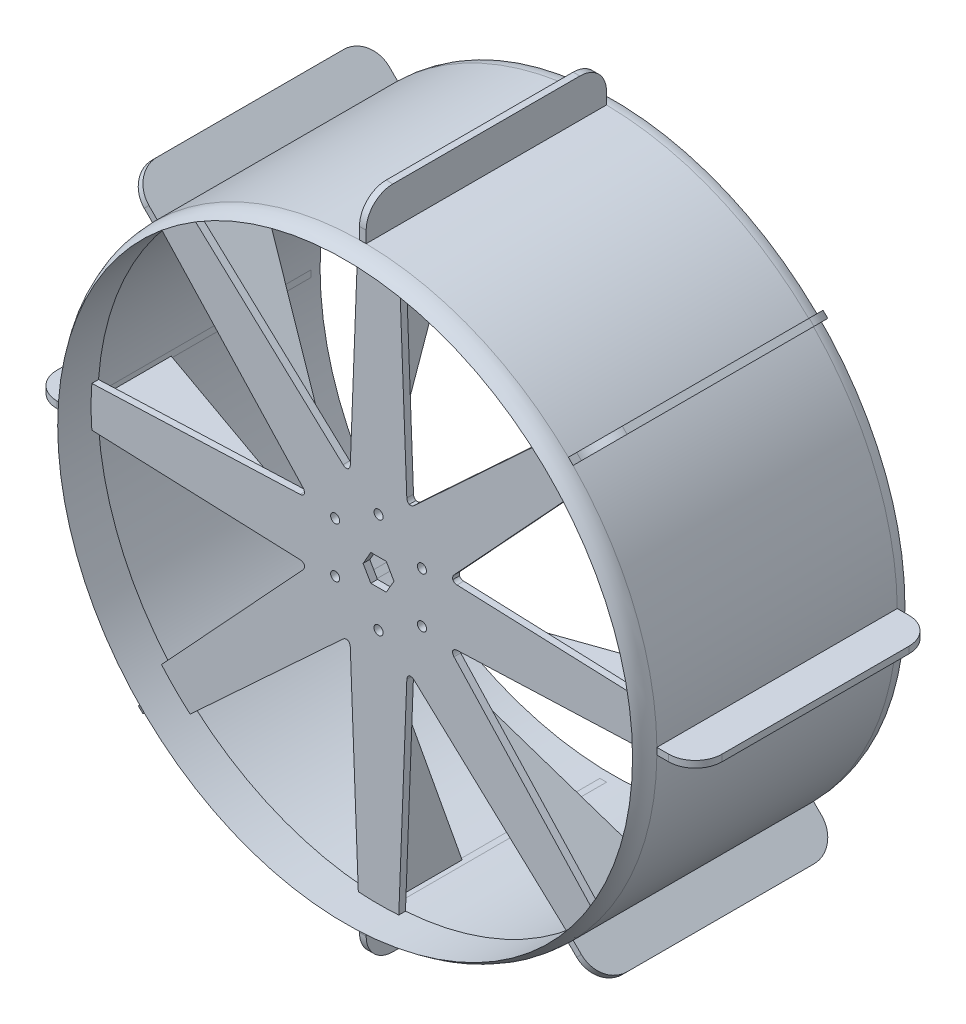
from build123d import *

# Parameters (mm, degrees)
SKETCH1_R                 = 139.7
BOSS_EXTRUDE1_DEPTH       = 127
SKETCH2_R                 = 138.90625
CUT_EXTRUDE1_DEPTH        = 107.95
SKETCH3_R                 = 136.525
CUT_EXTRUDE2_DEPTH        = 15.875
CUT_EXTRUDE3_REACH        = 228.674
SKETCH5_R                 = 2.15011
CUT_EXTRUDE4_DEPTH        = 227.673654457
CIRPATTERN2_COUNT         = 6
CUT_EXTRUDE5_REACH        = 228.674
SKETCH6_R                 = 136.525
SKETCH6_R_2               = 38.1
BOSS_EXTRUDE2_DEPTH       = 3.175
CIRPATTERN3_COUNT         = 8
FILLET2_R                 = 2.54
BOSS_EXTRUDE3_DEPTH       = 1.5875
CIRPATTERN4_COUNT         = 8
FILLET3_R                 = 12.7
SKETCH10_W                = 114.180326624
SKETCH10_H                = 19.05
BOSS_EXTRUDE5_DEPTH       = 1.5875
FILLET5_R                 = 12.7
CIRPATTERN14_COUNT        = 8
FILLET5_OF_CIRPATTERN14_R = 12.7


with BuildPart() as part:
    # Sketch1 → Boss-Extrude1 (new body)
    with BuildSketch(Plane.XY):
        Circle(SKETCH1_R)
    extrude(amount=BOSS_EXTRUDE1_DEPTH)

    # Sketch2 → Cut-Extrude1 (cut)
    with BuildSketch(Plane(origin=(0, 0, 0), x_dir=(-1, 0, 0), z_dir=(0, 0, -1))):
        Circle(SKETCH2_R)
    extrude(amount=-CUT_EXTRUDE1_DEPTH, mode=Mode.SUBTRACT)

    # Sketch3 → Cut-Extrude2 (cut)
    with BuildSketch(Plane.XY.offset(127)):
        Circle(SKETCH3_R)
    extrude(amount=-CUT_EXTRUDE2_DEPTH, mode=Mode.SUBTRACT)

    # Sketch4 → Cut-Extrude3 (cut, up to next)
    with BuildSketch(Plane.XY.offset(111.125), mode=Mode.PRIVATE) as cut_extrude3_sk1:
        Polygon((3.666174209, 6.35), (-3.666174209, 6.35), (-7.332348419, 0), (-3.666174209, -6.35), (3.666174209, -6.35), (7.332348419, 0), align=None)
    cut_extrude3_tool1 = extrude(cut_extrude3_sk1.sketch, amount=-CUT_EXTRUDE3_REACH, mode=Mode.PRIVATE) & part.part
    add(cut_extrude3_tool1.solids().sort_by_distance((0, 0, 111.125))[0], mode=Mode.SUBTRACT)

    # Sketch5 → Cut-Extrude4 (cut, through all)
    with BuildSketch(Plane.XY.offset(111.125)):
        with Locations((0, -23.8125)):
            Circle(SKETCH5_R)
    cut_extrude4 = extrude(amount=-CUT_EXTRUDE4_DEPTH, mode=Mode.SUBTRACT)

    # CirPattern2: Cut-Extrude4 ×6 about axis
    cirpattern2_axis = Axis((0, 0, 0), (0, 0, 1))
    for i in range(1, CIRPATTERN2_COUNT):
        add(cut_extrude4.rotate(cirpattern2_axis, i * 360 / CIRPATTERN2_COUNT), mode=Mode.SUBTRACT)

    # Sketch6 → Cut-Extrude5 (cut, up to next)
    with BuildSketch(Plane.XY.offset(111.125), mode=Mode.PRIVATE) as cut_extrude5_sk1:
        Circle(SKETCH6_R)
        Circle(SKETCH6_R_2, mode=Mode.SUBTRACT)
    cut_extrude5_tool1 = extrude(cut_extrude5_sk1.sketch, amount=-CUT_EXTRUDE5_REACH, mode=Mode.PRIVATE) & part.part
    add(cut_extrude5_tool1.solids().sort_by_distance((-132.66349, 0, 111.125))[0], mode=Mode.SUBTRACT)


with BuildPart() as cut_extrude5_piece_1:
    # of the separate pieces the step leaves, piece 1, a body of its own (cut_extrude5_pieces)
    add(part.part.solids().sort_by_distance((139.7, 0, 0))[0])



with BuildPart() as cut_extrude5_piece_2:
    # of the separate pieces the step leaves, piece 2, a body of its own (cut_extrude5_pieces)
    add(part.part.solids().sort_by_distance((38.1, 0, 111.125))[0])


with BuildPart() as cut_extrude5_piece_1_1:
    add(cut_extrude5_piece_1.part)

    add(cut_extrude5_piece_2.part)  # Boss-Extrude2 merges Cut-Extrude5 piece 2
    # Sketch7 → Boss-Extrude2 (add)
    with BuildSketch(Plane.XY.offset(111.125)):
        with BuildLine():
            Line((-9.525, 138.579293778), (-13.49375, 35.630446404))
            ThreePointArc((-13.49375, 35.630446404), (0, 38.1), (13.49375, 35.630446404))
            Line((13.49375, 35.630446404), (9.525, 138.579293778))
            ThreePointArc((9.525, 138.579293778), (0, 138.90625), (-9.525, 138.579293778))
        make_face()
    boss_extrude2 = extrude(amount=-BOSS_EXTRUDE2_DEPTH)

    # CirPattern3: Boss-Extrude2 ×8 about axis
    cirpattern3_axis = Axis((0, 0, 0), (0, 0, 1))
    for i in range(1, CIRPATTERN3_COUNT):
        add(boss_extrude2.rotate(cirpattern3_axis, i * 360 / CIRPATTERN3_COUNT))

    # Fillet2
    # the kernel refuses this fillet: 2.54 mm, written as the material it adds along each edge
    with BuildSketch(Plane(origin=(35.630446404, 13.49375, 111.125), x_dir=(-0.3736280373482853, 0.9275786164564535, 0), z_dir=(0, 0, -1)), Plane(origin=(34.736052398, -15.65300814, 111.125), x_dir=(0.3917022109295996, 0.9200920486303876, 0), z_dir=(0, 0, -1)), Plane(origin=(13.49375, -35.630446404, 111.125), x_dir=(0.9275786164564527, 0.37362803734828726, 0), z_dir=(0, 0, -1)), Plane(origin=(-15.65300814, -34.736052398, 111.125), x_dir=(0.9200920486303856, -0.39170221092960417, 0), z_dir=(0, 0, -1)), Plane(origin=(-35.630446404, -13.49375, 111.125), x_dir=(0.3736280373482815, -0.927578616456455, 0), z_dir=(0, 0, -1)), Plane(origin=(-34.736052398, 15.65300814, 111.125), x_dir=(-0.3917022109296025, -0.9200920486303863, 0), z_dir=(0, 0, -1)), Plane(origin=(-13.49375, 35.630446404, 111.125), x_dir=(-0.9275786164564532, -0.3736280373482857, 0), z_dir=(0, 0, -1)), Plane(origin=(15.65300814, 34.736052398, 111.125), x_dir=(-0.9200920486303862, 0.39170221092960295, 0), z_dir=(0, 0, -1))) as fillet2_piece_1:
        with BuildLine():
            CenterArc((1.645107595, 2.539445567), FILLET2_R, 204.147241631, 64.655595798)
            Line((-0.672635267, 1.500374815), (0, 0))
            ThreePointArc((0, 0), (0.796019804, 0.008316492), (1.592039608, 0))
        make_face()
    extrude(amount=3.175)
    with BuildSketch(Plane(origin=(34.736052398, 15.65300814, 111.125), x_dir=(0.6793427033647269, 0.7338211576297761, 0), z_dir=(0, 0, -1)), Plane(origin=(35.630446404, -13.49375, 111.125), x_dir=(0.9992577490369768, 0.03852208443937447, 0), z_dir=(0, 0, -1)), Plane(origin=(15.65300814, -34.736052398, 111.125), x_dir=(0.733821157629774, -0.6793427033647292, 0), z_dir=(0, 0, -1)), Plane(origin=(-13.49375, -35.630446404, 111.125), x_dir=(0.03852208443937447, -0.9992577490369768, 0), z_dir=(0, 0, -1)), Plane(origin=(-34.736052398, -15.65300814, 111.125), x_dir=(-0.6793427033647299, -0.7338211576297733, 0), z_dir=(0, 0, -1)), Plane(origin=(-35.630446404, 13.49375, 111.125), x_dir=(-0.9992577490369768, -0.03852208443937414, 0), z_dir=(0, 0, -1)), Plane(origin=(-15.65300814, 34.736052398, 111.125), x_dir=(-0.7338211576297734, 0.6793427033647298, 0), z_dir=(0, 0, -1))) as fillet2_piece_2:
        with BuildLine():
            CenterArc((1.644251437, 2.54), FILLET2_R, 205.344404202, 64.655595798)
            ThreePointArc((-0.651276296, 1.452731668), (-0.318049373, 0.729767969), (0, 0))
            Line((0, 0), (1.644251437, 0))
        make_face()
    extrude(amount=3.175)
    with BuildSketch(Plane(origin=(13.49375, 35.630446404, 111.125), x_dir=(0.9275786164564517, -0.37362803734828953, 0), z_dir=(0, 0, -1))) as fillet2_piece_3:
        with BuildLine():
            CenterArc((1.645107595, -2.539445567), FILLET2_R, 91.197162571, 64.655595798)
            Line((-0.672635267, -1.500374815), (0, 0))
            ThreePointArc((0, 0), (0.796019804, -0.008316492), (1.592039608, 0))
        make_face()
    extrude(amount=3.175)

    # Sketch9 → Boss-Extrude3 (add, symmetric)
    with BuildSketch(Plane(origin=(0, 0, 0), x_dir=(0, 0, -1), z_dir=(1, 0, 0))):
        Polygon((-107.95, -37.273477393), (-107.95, -136.587477393), (-73.025, -136.587477393), align=None)
    boss_extrude3 = extrude(amount=BOSS_EXTRUDE3_DEPTH, both=True)

    # CirPattern4: Boss-Extrude3 ×8 about axis
    cirpattern4_axis = Axis((0, 0, 0), (0, 0, 1))
    for i in range(1, CIRPATTERN4_COUNT):
        add(boss_extrude3.rotate(cirpattern4_axis, i * 360 / CIRPATTERN4_COUNT))

    # Fillet3
    # the kernel refuses this fillet: 12.7 mm, written as the material it takes off along each edge
    with BuildSketch(Plane(origin=(0, 0, 127), x_dir=(1, 0, 0), z_dir=(0, -1, 0))) as fillet3_piece_1:
        with BuildLine():
            CenterArc((127, -8.400260413), FILLET3_R, 0, 41.409622109)
            Line((139.7, -8.400260413), (139.954, -8.400260413))
            Line((139.954, -8.400260413), (139.954, 0))
            Line((139.954, 0), (139.7, 0.254))
            ThreePointArc((139.7, 0.254), (138.1125, 0.254), (136.7155, 0.168005208))
            Line((136.7155, 0.168005208), (136.525, 0))
        make_face()
    revolve(axis=Axis((0, 0, 127), (0, 0, 1)), mode=Mode.SUBTRACT)
    with BuildSketch(Plane(origin=(0, 0, 0), x_dir=(1, 0, 0), z_dir=(0, -1, 0))) as fillet3_piece_2:
        with BuildLine():
            CenterArc((127, 4.419412963), FILLET3_R, 339.635865194, 20.364134806)
            Line((138.90625, 0), (139.144375, -0.088388259))
            ThreePointArc((139.144375, -0.088388259), (139.303125, -0.254), (139.7, -0.254))
            Line((139.7, -0.254), (139.954, 0))
            Line((139.954, 0), (139.954, 4.419412963))
            Line((139.954, 4.419412963), (139.7, 4.419412963))
        make_face()
    revolve(axis=Axis((0, 0, 0), (0, 0, 1)), mode=Mode.SUBTRACT)

    # Sketch10 → Boss-Extrude5 (add, symmetric)
    with BuildSketch(Plane(origin=(0, 0, 0), x_dir=(0, 0, -1), z_dir=(1, 0, 0))):
        with Locations((-61.509576275, 148.42236)):
            Rectangle(SKETCH10_W, SKETCH10_H)
    boss_extrude5 = extrude(amount=BOSS_EXTRUDE5_DEPTH, both=True)

    # Fillet5
    fillet5_edges = [cut_extrude5_piece_1_1.edges().sort_by_distance(p)[0] for p in [
        (0, 157.94736, 118.599739587),
        (0, 157.94736, 4.419412963),
    ]]
    fillet(fillet5_edges, radius=FILLET5_R)

    # CirPattern14: Boss-Extrude5 ×8 about axis
    cirpattern14_axis = Axis((0, 0, 0), (0, 0, 1))
    for i in range(1, CIRPATTERN14_COUNT):
        add(boss_extrude5.rotate(cirpattern14_axis, i * 360 / CIRPATTERN14_COUNT))

    # Fillet5 of CirPattern14
    fillet5_of_cirpattern14_edges = [cut_extrude5_piece_1_1.edges().sort_by_distance(p)[0] for p in [
        (-111.685649327, 111.685649327, 118.599739587),
        (-111.685649327, 111.685649327, 4.419412963),
        (-157.94736, 0, 118.599739587),
        (-157.94736, 0, 4.419412963),
        (-111.685649327, -111.685649327, 118.599739587),
        (-111.685649327, -111.685649327, 4.419412963),
        (0, -157.94736, 118.599739587),
        (0, -157.94736, 4.419412963),
        (111.685649327, -111.685649327, 118.599739587),
        (111.685649327, -111.685649327, 4.419412963),
        (157.94736, 0, 118.599739587),
        (157.94736, 0, 4.419412963),
        (111.685649327, 111.685649327, 118.599739587),
        (111.685649327, 111.685649327, 4.419412963),
    ]]
    fillet(fillet5_of_cirpattern14_edges, radius=FILLET5_OF_CIRPATTERN14_R)


solid = cut_extrude5_piece_1_1.part
